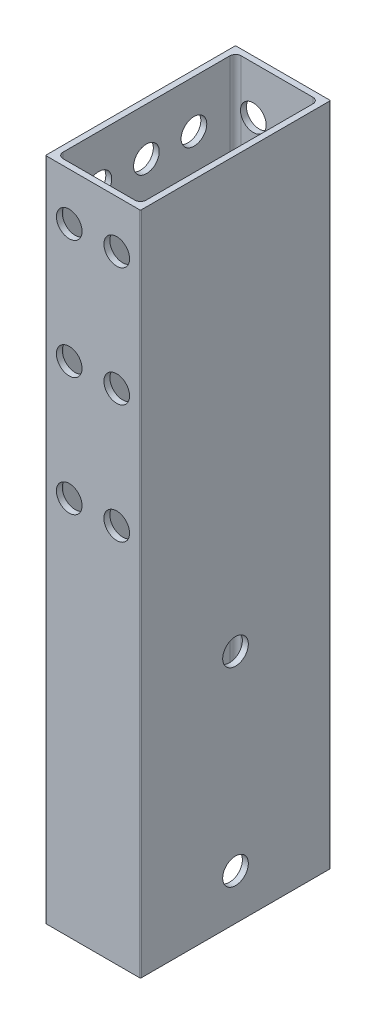
from build123d import *

# Parameters (mm, degrees)
BOSS_EXTRUDE1_DEPTH = 177.8
SKETCH2_R           = 10.16
SKETCH2_R_2         = 3.429
CUT_EXTRUDE1_DEPTH  = 12.7
SKETCH2_3_R         = 3.429
CUT_EXTRUDE2_DEPTH  = 187.6511184
SKETCH3_R           = 3.429
CUT_EXTRUDE3_DEPTH  = 187.6511184


with BuildPart() as part:
    # Sketch1 → Boss-Extrude1 (new body)
    with BuildSketch(Plane(origin=(0, 0, 0), x_dir=(1, 0, 0), z_dir=(0, 1, 0))):
        with BuildLine():
            Line((0.254, 50.8), (25.146, 50.8))
            ThreePointArc((25.146, 50.8), (25.325605122, 50.725605122), (25.4, 50.546))
            Line((25.4, 50.546), (25.4, 0.254))
            ThreePointArc((25.4, 0.254), (25.325605122, 0.074394878), (25.146, 0))
            Line((25.146, 0), (0.254, 0))
            ThreePointArc((0.254, 0), (0.074394878, 0.074394878), (0, 0.254))
            Line((0, 0.254), (0, 50.546))
            ThreePointArc((0, 50.546), (0.074394878, 50.725605122), (0.254, 50.8))
        make_face()
        with BuildLine():
            Line((1.5875, 3.1115), (1.5875, 47.6885))
            ThreePointArc((1.5875, 47.6885), (2.033869265, 48.766130735), (3.1115, 49.2125))
            Line((3.1115, 49.2125), (22.2885, 49.2125))
            ThreePointArc((22.2885, 49.2125), (23.366130735, 48.766130735), (23.8125, 47.6885))
            Line((23.8125, 47.6885), (23.8125, 3.1115))
            ThreePointArc((23.8125, 3.1115), (23.366130735, 2.033869265), (22.2885, 1.5875))
            Line((22.2885, 1.5875), (3.1115, 1.5875))
            ThreePointArc((3.1115, 1.5875), (2.033869265, 2.033869265), (1.5875, 3.1115))
        make_face(mode=Mode.SUBTRACT)
    extrude(amount=BOSS_EXTRUDE1_DEPTH)

    # Sketch2 → Cut-Extrude1 (cut)
    # profile 1 of 11: a face of its own
    with BuildSketch(Plane.ZY):
        with Locations((-25.4, 12.192)):
            Circle(SKETCH2_R)
        with Locations((-25.4, 12.192)):
            Circle(SKETCH2_R_2, mode=Mode.SUBTRACT)
    # profile 2 of 11: a face of its own
    with BuildSketch(Plane.ZY):
        with Locations((-25.4, 62.992)):
            Circle(SKETCH2_R)
        with Locations((-25.4, 62.992)):
            Circle(SKETCH2_R_2, mode=Mode.SUBTRACT)
    # profile 3 of 11: a face of its own
    with BuildSketch(Plane.ZY):
        with Locations((-38.1, 165.1)):
            Circle(SKETCH2_R_2)
    # profile 4 of 11: a face of its own
    with BuildSketch(Plane.ZY):
        with Locations((-25.4, 165.1)):
            Circle(SKETCH2_R_2)
    # profile 5 of 11: a face of its own
    with BuildSketch(Plane.ZY):
        with Locations((-12.7, 165.1)):
            Circle(SKETCH2_R_2)
    # profile 6 of 11: a face of its own
    with BuildSketch(Plane.ZY):
        with Locations((-25.4, 133.35)):
            Circle(SKETCH2_R_2)
    # profile 7 of 11: a face of its own
    with BuildSketch(Plane.ZY):
        with Locations((-12.7, 133.35)):
            Circle(SKETCH2_R_2)
    # profile 8 of 11: a face of its own
    with BuildSketch(Plane.ZY):
        with Locations((-25.4, 101.6)):
            Circle(SKETCH2_R_2)
    # profile 9 of 11: a face of its own
    with BuildSketch(Plane.ZY):
        with Locations((-12.7, 101.6)):
            Circle(SKETCH2_R_2)
    # profile 10 of 11: a face of its own
    with BuildSketch(Plane.ZY):
        with Locations((-38.1, 133.35)):
            Circle(SKETCH2_R_2)
    # profile 11 of 11: a face of its own
    with BuildSketch(Plane.ZY):
        with Locations((-38.1, 101.6)):
            Circle(SKETCH2_R_2)
    extrude(amount=-CUT_EXTRUDE1_DEPTH, mode=Mode.SUBTRACT)


with BuildPart() as cut_extrude1_piece_1:
    # of the separate pieces the step leaves, piece 1, a body of its own (cut_extrude1_pieces)
    add(part.part.solids().sort_by_distance((0, 0, -50.546))[0])


with BuildPart() as cut_extrude1_piece_2:
    # of the separate pieces the step leaves, piece 2, a body of its own (cut_extrude1_pieces)
    add(part.part.solids().sort_by_distance((0, 62.992, -21.971))[0])


with BuildPart() as cut_extrude1_piece_3:
    # of the separate pieces the step leaves, piece 3, a body of its own (cut_extrude1_pieces)
    add(part.part.solids().sort_by_distance((0, 12.192, -21.971))[0])


with BuildPart() as cut_extrude2_tool:
    # Sketch2<3> → Cut-Extrude2 (new, through all)
    with BuildSketch(Plane.ZY):
        with Locations((-25.4, 12.192)):
            Circle(SKETCH2_3_R)
        with Locations((-25.4, 62.992)):
            Circle(SKETCH2_3_R)
    extrude(amount=-CUT_EXTRUDE2_DEPTH)


with BuildPart() as cut_extrude1_piece_1_1:
    add(cut_extrude1_piece_1.part)

    # Cut-Extrude2: cut by cut_extrude2_tool
    add(cut_extrude2_tool.part, mode=Mode.SUBTRACT)

    # Sketch3 → Cut-Extrude3 (cut, through all)
    with BuildSketch(Plane.XY):
        with Locations((19.05, 165.1)):
            Circle(SKETCH3_R)
        with Locations((6.35, 165.1)):
            Circle(SKETCH3_R)
        with Locations((6.35, 133.35)):
            Circle(SKETCH3_R)
        with Locations((6.35, 101.6)):
            Circle(SKETCH3_R)
        with Locations((19.05, 133.35)):
            Circle(SKETCH3_R)
        with Locations((19.05, 101.6)):
            Circle(SKETCH3_R)
    extrude(amount=-CUT_EXTRUDE3_DEPTH, mode=Mode.SUBTRACT)


with BuildPart() as cut_extrude1_piece_2_1:
    add(cut_extrude1_piece_2.part)

    # Cut-Extrude2: cut by cut_extrude2_tool
    add(cut_extrude2_tool.part, mode=Mode.SUBTRACT)


with BuildPart() as cut_extrude1_piece_3_1:
    add(cut_extrude1_piece_3.part)

    # Cut-Extrude2: cut by cut_extrude2_tool
    add(cut_extrude2_tool.part, mode=Mode.SUBTRACT)


solid = cut_extrude1_piece_1_1.part
